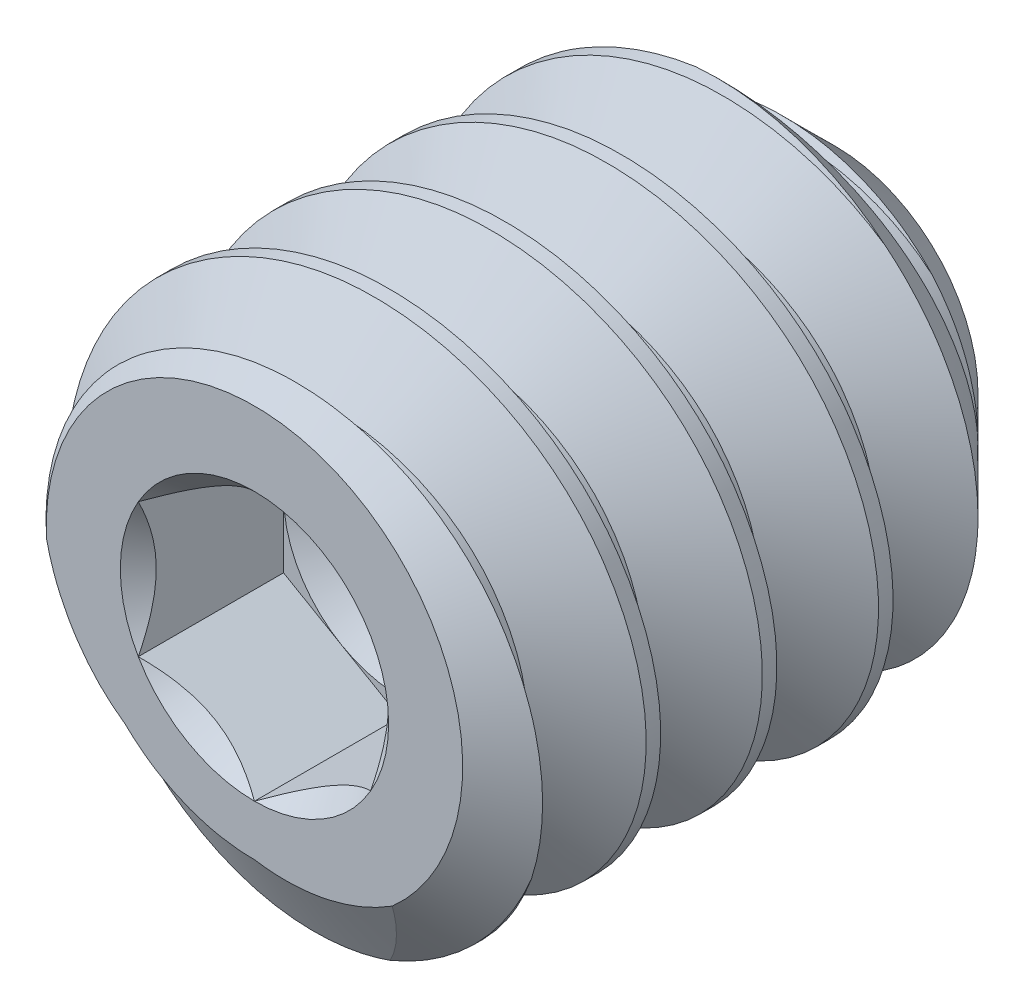
from build123d import *

# Parameters (mm, degrees)
CUT_SWEEP2_PITCH    = 0.635
CUT_EXTRUDE10_DEPTH = 0.79375


with BuildPart() as part:
    # Sketch22 → Revolve1 (revolve)
    with BuildSketch(Plane(origin=(0, 0, 0), x_dir=(0, 0, -1), z_dir=(1, 0, 0)), mode=Mode.PRIVATE) as revolve1_sk:
        Polygon((-1.353337021, 0), (-1.353337021, 1.13792), (-1.154141981, 1.4224), (1.178688262, 1.4224), (1.821662979, 0.779425283), (1.353337021, 0), align=None)
    revolve(revolve1_sk.sketch.rotate(Axis((0, 0, -1.353337021), (0, 0, -1)), 180), axis=Axis((0, 0, -1.353337021), (0, 0, -1)))

    # Cut-Sweep2: the profile of Sketch28 profile screwed along a right-hand helix of 6 turns, 6 arcs to a turn; built about Z, then put on its axis
    cut_sweep2_z = Axis((0, 0, 0), (0, 0, 1))
    cut_sweep2_corners = [(1.4227, 0, 0.000173205), (1.4227, 0, -0.555798205), (1.009955401, 0, -0.3175), (1.009955401, 0, -0.238125)]
    with BuildLine(mode=Mode.PRIVATE) as cut_sweep2_profile:
        Line(cut_sweep2_corners[0], cut_sweep2_corners[1])
        Line(cut_sweep2_corners[1], cut_sweep2_corners[2])
        Line(cut_sweep2_corners[2], cut_sweep2_corners[3])
        Line(cut_sweep2_corners[3], cut_sweep2_corners[0])
    cut_sweep2_cap = Face(cut_sweep2_profile.wire())
    cut_sweep2_turn_angles = [0, 30, 60, 90, 120, 150, 180, 210, 240, 270, 300, 330, 360]
    cut_sweep2_turn_weights = [1, 0.8660254037844387, 1, 0.8660254037844387, 1, 0.8660254037844387, 1, 0.8660254037844387, 1, 0.8660254037844387, 1, 0.8660254037844387, 1]
    cut_sweep2_turn_rails = [Edge.make_bspline([Vector(p[0], p[1], 0).rotate(cut_sweep2_z, cut_sweep2_turn_angles[k]) / cut_sweep2_turn_weights[k] + Vector(0, 0, p[2] + CUT_SWEEP2_PITCH * cut_sweep2_turn_angles[k] / 360) for k in range(13)], [0, 0, 0, 1, 1, 2, 2, 3, 3, 4, 4, 5, 5, 6, 6, 6], 2, cut_sweep2_turn_weights) for p in cut_sweep2_corners]
    cut_sweep2_turn_sides = [Face.make_surface_from_curves(cut_sweep2_turn_rails[p[0]], cut_sweep2_turn_rails[p[1]]) for p in [(0, 1), (1, 2), (2, 3), (3, 0)]]
    cut_sweep2 = Plane(origin=(0, 0, -1.821662979), x_dir=(0, 1, 0), z_dir=(0, 0, 1)) * Solid(Shell([*[p.moved(Location((0, 0, CUT_SWEEP2_PITCH * i))) for i in range(6) for p in cut_sweep2_turn_sides], cut_sweep2_cap, cut_sweep2_cap.rotate(cut_sweep2_z, 2160).moved(Location((0, 0, CUT_SWEEP2_PITCH * 2160 / 360)))]))
    add(cut_sweep2, mode=Mode.SUBTRACT)

    # Sketch23 → Cut-Extrude10 (cut)
    with BuildSketch(Plane.XY.offset(1.353337021)):
        Polygon((0, 0.733234842), (-0.635, 0.366617421), (-0.635, -0.366617421), (0, -0.733234842), (0.635, -0.366617421), (0.635, 0.366617421), align=None)
    extrude(amount=-CUT_EXTRUDE10_DEPTH, mode=Mode.SUBTRACT)

    # Cut-Extrude11 cone 1 section (through the dimple's axis) → Cut-Extrude11 (revolve, cut)
    with BuildSketch(Plane(origin=(0, 0, 1.353337021), x_dir=(0, -1, 0), z_dir=(1, 0, 0))):
        Polygon((0, 0), (0.733234842, 0), (0, 0.733234842), align=None)
    revolve(axis=Axis((0, 0, 1.353337021), (0, 0, -1)), mode=Mode.SUBTRACT)

    # Cut-Extrude12 cone 1 section (through the dimple's axis) → Cut-Extrude12 (revolve, cut)
    with BuildSketch(Plane(origin=(0, 0, 0.559587021), x_dir=(0, -1, 0), z_dir=(1, 0, 0))):
        Polygon((0, 0), (0.635, 0), (0, 0.366617421), align=None)
    revolve(axis=Axis((0, 0, 0.559587021), (0, 0, -1)), mode=Mode.SUBTRACT)


solid = part.part
